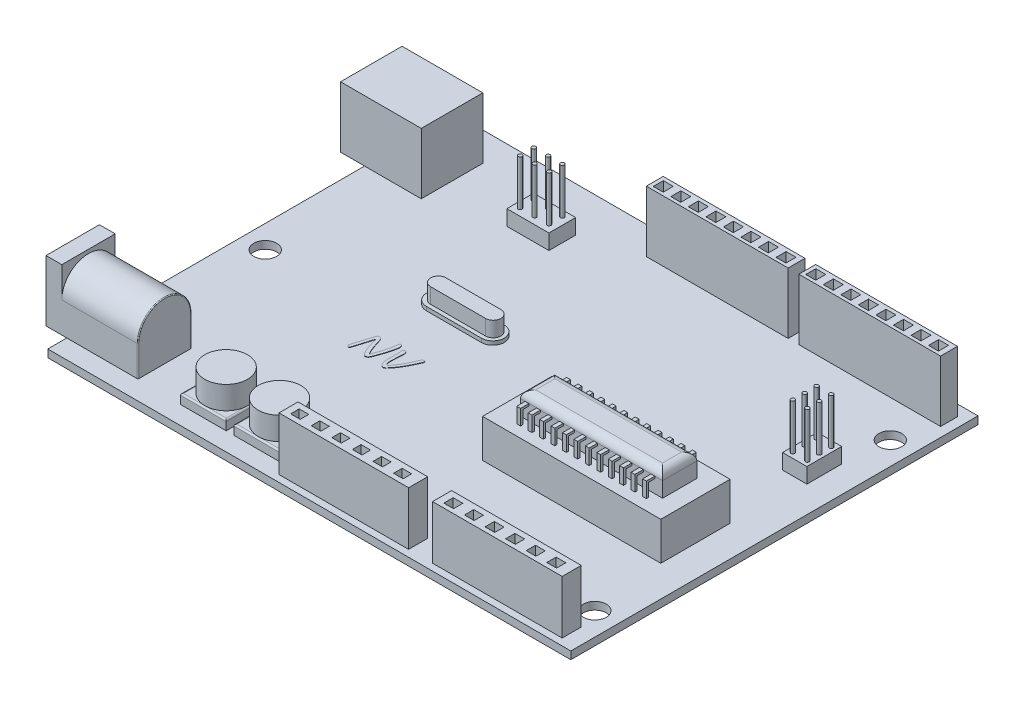
from build123d import *

# Parameters (mm, degrees)
SKETCH1_W                 = 68.6
SKETCH1_H                 = 53.4
BOSS_EXTRUDE1_DEPTH       = 1
SKETCH2_W                 = 17
SKETCH2_H                 = 2.5
BOSS_EXTRUDE2_DEPTH       = 7
SKETCH3_W                 = 1.250867438
SKETCH3_H                 = 1.125780694
CUT_EXTRUDE1_DEPTH        = 7
SKETCH4_W                 = 1.272885096
SKETCH4_H                 = 1.221969693
CUT_EXTRUDE2_DEPTH        = 7
SKETCH5_W                 = 6
SKETCH5_H                 = 6
BOSS_EXTRUDE3_DEPTH       = 1.25
SKETCH6_R                 = 2.8
BOSS_EXTRUDE4_DEPTH       = 3
SKETCH7_W                 = 12.070870776
SKETCH7_H                 = 7.004857653
BOSS_EXTRUDE5_DEPTH       = 8
CUT_EXTRUDE3_START        = -10
CUT_EXTRUDE3_DEPTH        = 10
SKETCH9_R                 = 2.5
SKETCH9_R_2               = 0.145183716
CUT_EXTRUDE4_DEPTH        = 10
FILLET1_R                 = 0.11
SKETCH10_W                = 10.586588213
SKETCH10_H                = 8.069045894
BOSS_EXTRUDE6_DEPTH       = 8
SKETCH11_W                = 2.827244698
SKETCH11_H                = 1.739842891
CUT_EXTRUDE5_DEPTH        = 8
FILLET2_R                 = 0.11
SKETCH12_W                = 23.37632425
SKETCH12_H                = 9.090792763
BOSS_EXTRUDE7_DEPTH       = 5
SKETCH13_W                = 18.636125166
SKETCH13_H                = 4.5
BOSS_EXTRUDE8_DEPTH       = 3
FILLET3_R                 = 1
SKETCH18_W                = 18.593917913
SKETCH18_H                = 2.209711983
BOSS_EXTRUDE9_DEPTH       = 8
SKETCH19_W                = 1.298853985
SKETCH19_H                = 1.323131629
CUT_EXTRUDE6_DEPTH        = 8
LPATTERN1_COUNT           = 8
LPATTERN1_PITCH           = 2.3
LPATTERN3_COUNT           = 2
LPATTERN3_PITCH           = 20
LPATTERN3_COPY_1_SKETCH_W = 1.298853985
LPATTERN3_COPY_1_SKETCH_H = 1.323131629
LPATTERN3_COPY_1_DEPTH    = 8
LPATTERN3_COPY_2_SKETCH_W = 1.298853985
LPATTERN3_COPY_2_SKETCH_H = 1.323131629
LPATTERN3_COPY_2_DEPTH    = 8
LPATTERN3_COPY_3_SKETCH_W = 1.298853985
LPATTERN3_COPY_3_SKETCH_H = 1.323131629
LPATTERN3_COPY_3_DEPTH    = 8
LPATTERN3_COPY_4_SKETCH_W = 1.298853985
LPATTERN3_COPY_4_SKETCH_H = 1.323131629
LPATTERN3_COPY_4_DEPTH    = 8
LPATTERN3_COPY_5_SKETCH_W = 1.298853985
LPATTERN3_COPY_5_SKETCH_H = 1.323131629
LPATTERN3_COPY_5_DEPTH    = 8
LPATTERN3_COPY_6_SKETCH_W = 1.298853985
LPATTERN3_COPY_6_SKETCH_H = 1.323131629
LPATTERN3_COPY_6_DEPTH    = 8
LPATTERN3_COPY_7_SKETCH_W = 1.298853985
LPATTERN3_COPY_7_SKETCH_H = 1.323131629
LPATTERN3_COPY_7_DEPTH    = 8
BOSS_EXTRUDE12_DEPTH      = 0.5
BOSS_EXTRUDE13_DEPTH      = 2
SKETCH24_W                = 0.493067156
SKETCH24_H                = 0.308166972
BOSS_EXTRUDE14_DEPTH      = 2
BOSS_EXTRUDE15_REACH      = 79.92
SKETCH26_W                = 0.493067156
SKETCH26_H                = 0.283057265
LPATTERN4_COUNT           = 12
LPATTERN4_PITCH           = 1.5
MIRROR1_COPY_1_SKETCH_W   = 0.493067156
MIRROR1_COPY_1_SKETCH_H   = 0.308166972
MIRROR1_COPY_1_DEPTH      = 2
MIRROR1_COPY_2_SKETCH_W   = 0.493067156
MIRROR1_COPY_2_SKETCH_H   = 0.308166972
MIRROR1_COPY_2_DEPTH      = 2
MIRROR1_COPY_3_SKETCH_W   = 0.493067156
MIRROR1_COPY_3_SKETCH_H   = 0.308166972
MIRROR1_COPY_3_DEPTH      = 2
MIRROR1_COPY_4_SKETCH_W   = 0.493067156
MIRROR1_COPY_4_SKETCH_H   = 0.308166972
MIRROR1_COPY_4_DEPTH      = 2
MIRROR1_COPY_5_SKETCH_W   = 0.493067156
MIRROR1_COPY_5_SKETCH_H   = 0.308166972
MIRROR1_COPY_5_DEPTH      = 2
MIRROR1_COPY_6_SKETCH_W   = 0.493067156
MIRROR1_COPY_6_SKETCH_H   = 0.308166972
MIRROR1_COPY_6_DEPTH      = 2
MIRROR1_COPY_7_SKETCH_W   = 0.493067156
MIRROR1_COPY_7_SKETCH_H   = 0.308166972
MIRROR1_COPY_7_DEPTH      = 2
MIRROR1_COPY_8_SKETCH_W   = 0.493067156
MIRROR1_COPY_8_SKETCH_H   = 0.308166972
MIRROR1_COPY_8_DEPTH      = 2
MIRROR1_COPY_9_SKETCH_W   = 0.493067156
MIRROR1_COPY_9_SKETCH_H   = 0.308166972
MIRROR1_COPY_9_DEPTH      = 2
MIRROR1_COPY_10_SKETCH_W  = 0.493067156
MIRROR1_COPY_10_SKETCH_H  = 0.308166972
MIRROR1_COPY_10_DEPTH     = 2
MIRROR1_COPY_11_SKETCH_W  = 0.493067156
MIRROR1_COPY_11_SKETCH_H  = 0.308166972
MIRROR1_COPY_11_DEPTH     = 2
MIRROR1_COPY_12_REACH     = 79.92
MIRROR1_COPY_12_SKETCH_W  = 0.493067156
MIRROR1_COPY_12_SKETCH_H  = 0.283057265
MIRROR1_COPY_13_REACH     = 79.92
MIRROR1_COPY_13_SKETCH_W  = 0.493067156
MIRROR1_COPY_13_SKETCH_H  = 0.283057265
MIRROR1_COPY_14_REACH     = 79.92
MIRROR1_COPY_14_SKETCH_W  = 0.493067156
MIRROR1_COPY_14_SKETCH_H  = 0.283057265
MIRROR1_COPY_15_REACH     = 79.92
MIRROR1_COPY_15_SKETCH_W  = 0.493067156
MIRROR1_COPY_15_SKETCH_H  = 0.283057265
MIRROR1_COPY_16_REACH     = 79.92
MIRROR1_COPY_16_SKETCH_W  = 0.493067156
MIRROR1_COPY_16_SKETCH_H  = 0.283057265
MIRROR1_COPY_17_REACH     = 79.92
MIRROR1_COPY_17_SKETCH_W  = 0.493067156
MIRROR1_COPY_17_SKETCH_H  = 0.283057265
MIRROR1_COPY_18_REACH     = 79.92
MIRROR1_COPY_18_SKETCH_W  = 0.493067156
MIRROR1_COPY_18_SKETCH_H  = 0.283057265
MIRROR1_COPY_19_REACH     = 79.92
MIRROR1_COPY_19_SKETCH_W  = 0.493067156
MIRROR1_COPY_19_SKETCH_H  = 0.283057265
MIRROR1_COPY_20_REACH     = 79.92
MIRROR1_COPY_20_SKETCH_W  = 0.493067156
MIRROR1_COPY_20_SKETCH_H  = 0.283057265
MIRROR1_COPY_21_REACH     = 79.92
MIRROR1_COPY_21_SKETCH_W  = 0.493067156
MIRROR1_COPY_21_SKETCH_H  = 0.283057265
MIRROR1_COPY_22_REACH     = 79.92
MIRROR1_COPY_22_SKETCH_W  = 0.493067156
MIRROR1_COPY_22_SKETCH_H  = 0.283057265
SKETCH27_W                = 5.519409892
SKETCH27_H                = 3.506448638
BOSS_EXTRUDE16_DEPTH      = 2
SKETCH28_R                = 0.25
BOSS_EXTRUDE17_DEPTH      = 6
SKETCH33_W                = 3.184955376
SKETCH33_H                = 4.555757605
BOSS_EXTRUDE20_DEPTH      = 2
SKETCH34_R                = 0.25
BOSS_EXTRUDE21_DEPTH      = 6
BOSS_EXTRUDE22_DEPTH      = 0.05
FILLET5_R                 = 0.2
SKETCH36_R                = 1.5
CUT_EXTRUDE7_DEPTH        = 88.301317426


# Read off the part's stored shape, not the designer's step: Cut-Extrude3
with BuildPart() as part:
    # Sketch1 → Boss-Extrude1 (new body)
    with BuildSketch(Plane(origin=(0, 0, 0), x_dir=(1, 0, 0), z_dir=(0, 1, 0))):
        with Locations((34.3, -26.7)):
            Rectangle(SKETCH1_W, SKETCH1_H)
    extrude(amount=BOSS_EXTRUDE1_DEPTH)

    # Sketch2 → Boss-Extrude2 (add)
    with BuildSketch(Plane(origin=(0, 1, 0), x_dir=(1, 0, 0), z_dir=(0, 1, 0))):
        with Locations((58.06648132, -51.25)):
            Rectangle(SKETCH2_W, SKETCH2_H)
        with Locations((37.921616992, -51.25)):
            Rectangle(SKETCH2_W, SKETCH2_H)
    extrude(amount=BOSS_EXTRUDE2_DEPTH)

    # Sketch3 → Cut-Extrude1 (cut)
    with BuildSketch(Plane(origin=(0, 8, 0), x_dir=(1, 0, 0), z_dir=(0, 1, 0))):
        with Locations((33.622657918, -51.279545155)):
            Rectangle(SKETCH3_W, SKETCH3_H)
        with Locations((30.922657918, -51.279545155)):
            Rectangle(SKETCH3_W, SKETCH3_H)
        with Locations((36.322657918, -51.279545155)):
            Rectangle(SKETCH3_W, SKETCH3_H)
        with Locations((39.022657918, -51.279545155)):
            Rectangle(SKETCH3_W, SKETCH3_H)
        with Locations((41.722657918, -51.279545155)):
            Rectangle(SKETCH3_W, SKETCH3_H)
        with Locations((44.422657918, -51.279545155)):
            Rectangle(SKETCH3_W, SKETCH3_H)
    extrude(amount=-CUT_EXTRUDE1_DEPTH, mode=Mode.SUBTRACT)

    # Sketch4 → Cut-Extrude2 (cut)
    with BuildSketch(Plane(origin=(0, 8, 0), x_dir=(1, 0, 0), z_dir=(0, 1, 0))):
        with Locations((53.813633763, -51.319835509)):
            Rectangle(SKETCH4_W, SKETCH4_H)
        with Locations((51.113633763, -51.319835509)):
            Rectangle(SKETCH4_W, SKETCH4_H)
        with Locations((56.513633763, -51.319835509)):
            Rectangle(SKETCH4_W, SKETCH4_H)
        with Locations((59.213633763, -51.319835509)):
            Rectangle(SKETCH4_W, SKETCH4_H)
        with Locations((61.913633763, -51.319835509)):
            Rectangle(SKETCH4_W, SKETCH4_H)
        with Locations((64.613633763, -51.319835509)):
            Rectangle(SKETCH4_W, SKETCH4_H)
    extrude(amount=-CUT_EXTRUDE2_DEPTH, mode=Mode.SUBTRACT)

    # Sketch5 → Boss-Extrude3 (add)
    with BuildSketch(Plane(origin=(0, 1, 0), x_dir=(1, 0, 0), z_dir=(0, 1, 0))):
        with Locations((18, -48)):
            Rectangle(SKETCH5_W, SKETCH5_H)
        with Locations((25, -48)):
            Rectangle(SKETCH5_W, SKETCH5_H)
    extrude(amount=BOSS_EXTRUDE3_DEPTH)

    # Sketch6 → Boss-Extrude4 (add)
    with BuildSketch(Plane(origin=(0, 2.25, 0), x_dir=(1, 0, 0), z_dir=(0, 1, 0))):
        with Locations(Location((18, -48, 0), (0, 0, 270))):
            Circle(SKETCH6_R)
        with Locations(Location((25, -48, 0), (0, 0, 270))):
            Circle(SKETCH6_R)
    extrude(amount=BOSS_EXTRUDE4_DEPTH)

    # Sketch7 → Boss-Extrude5 (add)
    with BuildSketch(Plane(origin=(0, 1, 0), x_dir=(1, 0, 0), z_dir=(0, 1, 0))):
        with Locations((3.309759226, -47.401856098)):
            Rectangle(SKETCH7_W, SKETCH7_H)
    extrude(amount=BOSS_EXTRUDE5_DEPTH)

    # Cut-Extrude3 outline → Cut-Extrude3 (cut)
    with BuildSketch(Plane(origin=(9.345194614, 0, 0), x_dir=(0, 0, -1), z_dir=(1, 0, 0)).offset(CUT_EXTRUDE3_START)):
        with BuildLine():
            Line((-50.904284924, 9), (-50.904284924, 5))
            ThreePointArc((-50.904284924, 5), (-47.401856098, 8.502428826), (-43.899427271, 5))
            Line((-43.899427271, 5), (-43.899427271, 9))
            Line((-43.899427271, 9), (-50.904284924, 9))
        make_face()
    extrude(amount=CUT_EXTRUDE3_DEPTH, mode=Mode.SUBTRACT)

    # Sketch9 → Cut-Extrude4 (cut)
    with BuildSketch(Plane.ZY.offset(2.725676162)):
        with Locations((47.433127783, 5.128276599)):
            Circle(SKETCH9_R)
        with Locations((47.433127783, 5.128276599)):
            Circle(SKETCH9_R_2, mode=Mode.SUBTRACT)
    extrude(amount=-CUT_EXTRUDE4_DEPTH, mode=Mode.SUBTRACT)

    # Fillet1
    fillet1_edges = [part.edges().sort_by_distance(p)[0] for p in [
        (9.345194614, 3, 43.899427271),
        (9.345194614, 3, 50.904284924),
        (9.345194614, 8.502428826, 47.401856098),
        (-2.725676162, 5.128276599, 47.287944068),
    ]]
    fillet(fillet1_edges, radius=FILLET1_R)

    # Sketch10 → Boss-Extrude6 (add)
    with BuildSketch(Plane(origin=(0, 1, 0), x_dir=(1, 0, 0), z_dir=(0, 1, 0))):
        with Locations((2.145682788, -7.818432608)):
            Rectangle(SKETCH10_W, SKETCH10_H)
    extrude(amount=BOSS_EXTRUDE6_DEPTH)

    # Sketch11 → Cut-Extrude5 (cut)
    with BuildSketch(Plane.ZY.offset(3.147611319)):
        Polygon((5.435253555, 3.098459893), (5.435253555, 5.659895261), (6.474326393, 6.698968098), (9.301571091, 6.698968098), (10.340643928, 5.659895261), (10.340643928, 3.098459893), align=None)
        with Locations((7.887948742, 4.789973815)):
            Rectangle(SKETCH11_W, SKETCH11_H, mode=Mode.SUBTRACT)
    extrude(amount=-CUT_EXTRUDE5_DEPTH, mode=Mode.SUBTRACT)

    # Fillet2
    fillet2_edges = [part.edges().sort_by_distance(p)[0] for p in [
        (-3.147611319, 4.789973815, 6.474326393),
        (-3.147611319, 5.659895261, 7.887948742),
        (-3.147611319, 4.789973815, 9.301571091),
        (-3.147611319, 3.92005237, 7.887948742),
    ]]
    fillet(fillet2_edges, radius=FILLET2_R)

    # Sketch12 → Boss-Extrude7 (add)
    with BuildSketch(Plane(origin=(0, 1, 0), x_dir=(1, 0, 0), z_dir=(0, 1, 0))):
        with Locations((52.855806889, -32.9986207)):
            Rectangle(SKETCH12_W, SKETCH12_H)
    extrude(amount=BOSS_EXTRUDE7_DEPTH)

    # Sketch13 → Boss-Extrude8 (add)
    with BuildSketch(Plane(origin=(0, 6, 0), x_dir=(1, 0, 0), z_dir=(0, 1, 0))):
        with Locations((52.95320824, -32.794017082)):
            Rectangle(SKETCH13_W, SKETCH13_H)
    extrude(amount=BOSS_EXTRUDE8_DEPTH)

    # Fillet3
    fillet3_edges = [part.edges().sort_by_distance(p)[0] for p in [
        (43.635145657, 9, 32.794017082),
        (52.95320824, 9, 35.044017082),
        (62.271270823, 9, 32.794017082),
        (52.95320824, 9, 30.544017082),
    ]]
    fillet(fillet3_edges, radius=FILLET3_R)

    # Sketch18 → Boss-Extrude9 (add)
    with BuildSketch(Plane(origin=(0, 1, 0), x_dir=(1, 0, 0), z_dir=(0, 1, 0))):
        with Locations((38.056256007, -2.551542774)):
            Rectangle(SKETCH18_W, SKETCH18_H)
    boss_extrude9 = extrude(amount=BOSS_EXTRUDE9_DEPTH)

    # Sketch19 → Cut-Extrude6 (cut)
    with BuildSketch(Plane(origin=(0, 9, 0), x_dir=(1, 0, 0), z_dir=(0, 1, 0))):
        with Locations((29.900276696, -2.578233353)):
            Rectangle(SKETCH19_W, SKETCH19_H)
    cut_extrude6 = extrude(amount=-CUT_EXTRUDE6_DEPTH, mode=Mode.SUBTRACT)

    # LPattern1: Cut-Extrude6 ×8
    with Locations(*[(i * LPATTERN1_PITCH, 0, 0) for i in range(1, LPATTERN1_COUNT)]):
        add(cut_extrude6, mode=Mode.SUBTRACT)

    # LPattern3: Boss-Extrude9, Cut-Extrude6 ×2
    with Locations(*[(i * LPATTERN3_PITCH, 0, 0) for i in range(1, LPATTERN3_COUNT)]):
        add(boss_extrude9)
        add(cut_extrude6, mode=Mode.SUBTRACT)

    # LPattern3 copy 1 sketch → LPattern3 copy 1 (cut)
    with BuildSketch(Plane(origin=(22.3, 9, 0), x_dir=(1, 0, 0), z_dir=(0, 1, 0))):
        with Locations((29.900276696, -2.578233353)):
            Rectangle(LPATTERN3_COPY_1_SKETCH_W, LPATTERN3_COPY_1_SKETCH_H)
    extrude(amount=-LPATTERN3_COPY_1_DEPTH, mode=Mode.SUBTRACT)

    # LPattern3 copy 2 sketch → LPattern3 copy 2 (cut)
    with BuildSketch(Plane(origin=(24.6, 9, 0), x_dir=(1, 0, 0), z_dir=(0, 1, 0))):
        with Locations((29.900276696, -2.578233353)):
            Rectangle(LPATTERN3_COPY_2_SKETCH_W, LPATTERN3_COPY_2_SKETCH_H)
    extrude(amount=-LPATTERN3_COPY_2_DEPTH, mode=Mode.SUBTRACT)

    # LPattern3 copy 3 sketch → LPattern3 copy 3 (cut)
    with BuildSketch(Plane(origin=(26.9, 9, 0), x_dir=(1, 0, 0), z_dir=(0, 1, 0))):
        with Locations((29.900276696, -2.578233353)):
            Rectangle(LPATTERN3_COPY_3_SKETCH_W, LPATTERN3_COPY_3_SKETCH_H)
    extrude(amount=-LPATTERN3_COPY_3_DEPTH, mode=Mode.SUBTRACT)

    # LPattern3 copy 4 sketch → LPattern3 copy 4 (cut)
    with BuildSketch(Plane(origin=(29.2, 9, 0), x_dir=(1, 0, 0), z_dir=(0, 1, 0))):
        with Locations((29.900276696, -2.578233353)):
            Rectangle(LPATTERN3_COPY_4_SKETCH_W, LPATTERN3_COPY_4_SKETCH_H)
    extrude(amount=-LPATTERN3_COPY_4_DEPTH, mode=Mode.SUBTRACT)

    # LPattern3 copy 5 sketch → LPattern3 copy 5 (cut)
    with BuildSketch(Plane(origin=(31.5, 9, 0), x_dir=(1, 0, 0), z_dir=(0, 1, 0))):
        with Locations((29.900276696, -2.578233353)):
            Rectangle(LPATTERN3_COPY_5_SKETCH_W, LPATTERN3_COPY_5_SKETCH_H)
    extrude(amount=-LPATTERN3_COPY_5_DEPTH, mode=Mode.SUBTRACT)

    # LPattern3 copy 6 sketch → LPattern3 copy 6 (cut)
    with BuildSketch(Plane(origin=(33.8, 9, 0), x_dir=(1, 0, 0), z_dir=(0, 1, 0))):
        with Locations((29.900276696, -2.578233353)):
            Rectangle(LPATTERN3_COPY_6_SKETCH_W, LPATTERN3_COPY_6_SKETCH_H)
    extrude(amount=-LPATTERN3_COPY_6_DEPTH, mode=Mode.SUBTRACT)

    # LPattern3 copy 7 sketch → LPattern3 copy 7 (cut)
    with BuildSketch(Plane(origin=(36.1, 9, 0), x_dir=(1, 0, 0), z_dir=(0, 1, 0))):
        with Locations((29.900276696, -2.578233353)):
            Rectangle(LPATTERN3_COPY_7_SKETCH_W, LPATTERN3_COPY_7_SKETCH_H)
    extrude(amount=-LPATTERN3_COPY_7_DEPTH, mode=Mode.SUBTRACT)

    # Sketch22 → Boss-Extrude12 (add)
    with BuildSketch(Plane(origin=(0, 1, 0), x_dir=(1, 0, 0), z_dir=(0, 1, 0))):
        with BuildLine():
            Line((20.492984875, -21.236243014), (27.700684852, -21.236243014))
            ThreePointArc((27.700684852, -21.236243014), (29.200684852, -22.736243014), (27.700684852, -24.236243014))
            Line((27.700684852, -24.236243014), (20.492984875, -24.236243014))
            ThreePointArc((20.492984875, -24.236243014), (18.992984875, -22.736243014), (20.492984875, -21.236243014))
        make_face()
    extrude(amount=BOSS_EXTRUDE12_DEPTH)

    # Sketch23 → Boss-Extrude13 (add)
    with BuildSketch(Plane(origin=(0, 1.5, 0), x_dir=(1, 0, 0), z_dir=(0, 1, 0))):
        with BuildLine():
            Line((20.532869644, -21.71113498), (27.740569621, -21.71113498))
            ThreePointArc((27.740569621, -21.71113498), (28.747050248, -22.717615607), (27.740569621, -23.724096235))
            Line((27.740569621, -23.724096235), (20.532869644, -23.724096235))
            ThreePointArc((20.532869644, -23.724096235), (19.526389016, -22.717615607), (20.532869644, -21.71113498))
        make_face()
    extrude(amount=BOSS_EXTRUDE13_DEPTH)

    # Sketch24 → Boss-Extrude14 (add)
    with BuildSketch(Plane(origin=(0, 6, 0), x_dir=(1, 0, 0), z_dir=(0, 1, 0))):
        with Locations((44.50595764, -35.996011084)):
            Rectangle(SKETCH24_W, SKETCH24_H)
    boss_extrude14 = extrude(amount=BOSS_EXTRUDE14_DEPTH)

    # Sketch26 → Boss-Extrude15 (add, up to next)
    with BuildSketch(Plane(origin=(0, 0, 35.841927598), x_dir=(-1, 0, 0), z_dir=(0, 0, -1)), mode=Mode.PRIVATE) as boss_extrude15_sk1:
        with Locations((-44.50595764, 7.858471367)):
            Rectangle(SKETCH26_W, SKETCH26_H)
    boss_extrude15_tool1 = extrude(boss_extrude15_sk1.sketch, amount=BOSS_EXTRUDE15_REACH, mode=Mode.PRIVATE) - part.part
    boss_extrude15 = boss_extrude15_tool1.solids().sort_by_distance((44.505958, 7.858471, 35.841928))[0]
    add(boss_extrude15)

    # LPattern4: Boss-Extrude14, Boss-Extrude15 ×12
    with Locations(*[(i * LPATTERN4_PITCH, 0, 0) for i in range(1, LPATTERN4_COUNT)]):
        add(boss_extrude14)
        add(boss_extrude15)

    # Mirror1: Boss-Extrude14, Boss-Extrude15 across plane
    add(boss_extrude14.mirror(Plane.XY.offset(32.877393472)))
    add(boss_extrude15.mirror(Plane.XY.offset(32.877393472)))

    # Mirror1 copy 1 sketch → Mirror1 copy 1 (add)
    with BuildSketch(Plane(origin=(1.5, 6, 65.754786943), x_dir=(1, 0, 0), z_dir=(0, 1, 0))):
        with Locations((44.50595764, 35.996011084)):
            Rectangle(MIRROR1_COPY_1_SKETCH_W, MIRROR1_COPY_1_SKETCH_H)
    extrude(amount=MIRROR1_COPY_1_DEPTH)

    # Mirror1 copy 2 sketch → Mirror1 copy 2 (add)
    with BuildSketch(Plane(origin=(3, 6, 65.754786943), x_dir=(1, 0, 0), z_dir=(0, 1, 0))):
        with Locations((44.50595764, 35.996011084)):
            Rectangle(MIRROR1_COPY_2_SKETCH_W, MIRROR1_COPY_2_SKETCH_H)
    extrude(amount=MIRROR1_COPY_2_DEPTH)

    # Mirror1 copy 3 sketch → Mirror1 copy 3 (add)
    with BuildSketch(Plane(origin=(4.5, 6, 65.754786943), x_dir=(1, 0, 0), z_dir=(0, 1, 0))):
        with Locations((44.50595764, 35.996011084)):
            Rectangle(MIRROR1_COPY_3_SKETCH_W, MIRROR1_COPY_3_SKETCH_H)
    extrude(amount=MIRROR1_COPY_3_DEPTH)

    # Mirror1 copy 4 sketch → Mirror1 copy 4 (add)
    with BuildSketch(Plane(origin=(6, 6, 65.754786943), x_dir=(1, 0, 0), z_dir=(0, 1, 0))):
        with Locations((44.50595764, 35.996011084)):
            Rectangle(MIRROR1_COPY_4_SKETCH_W, MIRROR1_COPY_4_SKETCH_H)
    extrude(amount=MIRROR1_COPY_4_DEPTH)

    # Mirror1 copy 5 sketch → Mirror1 copy 5 (add)
    with BuildSketch(Plane(origin=(7.5, 6, 65.754786943), x_dir=(1, 0, 0), z_dir=(0, 1, 0))):
        with Locations((44.50595764, 35.996011084)):
            Rectangle(MIRROR1_COPY_5_SKETCH_W, MIRROR1_COPY_5_SKETCH_H)
    extrude(amount=MIRROR1_COPY_5_DEPTH)

    # Mirror1 copy 6 sketch → Mirror1 copy 6 (add)
    with BuildSketch(Plane(origin=(9, 6, 65.754786943), x_dir=(1, 0, 0), z_dir=(0, 1, 0))):
        with Locations((44.50595764, 35.996011084)):
            Rectangle(MIRROR1_COPY_6_SKETCH_W, MIRROR1_COPY_6_SKETCH_H)
    extrude(amount=MIRROR1_COPY_6_DEPTH)

    # Mirror1 copy 7 sketch → Mirror1 copy 7 (add)
    with BuildSketch(Plane(origin=(10.5, 6, 65.754786943), x_dir=(1, 0, 0), z_dir=(0, 1, 0))):
        with Locations((44.50595764, 35.996011084)):
            Rectangle(MIRROR1_COPY_7_SKETCH_W, MIRROR1_COPY_7_SKETCH_H)
    extrude(amount=MIRROR1_COPY_7_DEPTH)

    # Mirror1 copy 8 sketch → Mirror1 copy 8 (add)
    with BuildSketch(Plane(origin=(12, 6, 65.754786943), x_dir=(1, 0, 0), z_dir=(0, 1, 0))):
        with Locations((44.50595764, 35.996011084)):
            Rectangle(MIRROR1_COPY_8_SKETCH_W, MIRROR1_COPY_8_SKETCH_H)
    extrude(amount=MIRROR1_COPY_8_DEPTH)

    # Mirror1 copy 9 sketch → Mirror1 copy 9 (add)
    with BuildSketch(Plane(origin=(13.5, 6, 65.754786943), x_dir=(1, 0, 0), z_dir=(0, 1, 0))):
        with Locations((44.50595764, 35.996011084)):
            Rectangle(MIRROR1_COPY_9_SKETCH_W, MIRROR1_COPY_9_SKETCH_H)
    extrude(amount=MIRROR1_COPY_9_DEPTH)

    # Mirror1 copy 10 sketch → Mirror1 copy 10 (add)
    with BuildSketch(Plane(origin=(15, 6, 65.754786943), x_dir=(1, 0, 0), z_dir=(0, 1, 0))):
        with Locations((44.50595764, 35.996011084)):
            Rectangle(MIRROR1_COPY_10_SKETCH_W, MIRROR1_COPY_10_SKETCH_H)
    extrude(amount=MIRROR1_COPY_10_DEPTH)

    # Mirror1 copy 11 sketch → Mirror1 copy 11 (add)
    with BuildSketch(Plane(origin=(16.5, 6, 65.754786943), x_dir=(1, 0, 0), z_dir=(0, 1, 0))):
        with Locations((44.50595764, 35.996011084)):
            Rectangle(MIRROR1_COPY_11_SKETCH_W, MIRROR1_COPY_11_SKETCH_H)
    extrude(amount=MIRROR1_COPY_11_DEPTH)

    # Mirror1 copy 12 sketch → Mirror1 copy 12 (add, up to next)
    with BuildSketch(Plane(origin=(1.5, 0, 29.912859345), x_dir=(-1, 0, 0), z_dir=(0, 0, 1)), mode=Mode.PRIVATE) as mirror1_copy_12_sk1:
        with Locations((-44.50595764, -7.858471367)):
            Rectangle(MIRROR1_COPY_12_SKETCH_W, MIRROR1_COPY_12_SKETCH_H)
    mirror1_copy_12_tool1 = extrude(mirror1_copy_12_sk1.sketch, amount=MIRROR1_COPY_12_REACH, mode=Mode.PRIVATE) - part.part
    add(mirror1_copy_12_tool1.solids().sort_by_distance((46.005958, 7.858471, 29.912858943))[0])

    # Mirror1 copy 13 sketch → Mirror1 copy 13 (add, up to next)
    with BuildSketch(Plane(origin=(3, 0, 29.912859345), x_dir=(-1, 0, 0), z_dir=(0, 0, 1)), mode=Mode.PRIVATE) as mirror1_copy_13_sk1:
        with Locations((-44.50595764, -7.858471367)):
            Rectangle(MIRROR1_COPY_13_SKETCH_W, MIRROR1_COPY_13_SKETCH_H)
    mirror1_copy_13_tool1 = extrude(mirror1_copy_13_sk1.sketch, amount=MIRROR1_COPY_13_REACH, mode=Mode.PRIVATE) - part.part
    add(mirror1_copy_13_tool1.solids().sort_by_distance((47.505958, 7.858471, 29.912858943))[0])

    # Mirror1 copy 14 sketch → Mirror1 copy 14 (add, up to next)
    with BuildSketch(Plane(origin=(4.5, 0, 29.912859345), x_dir=(-1, 0, 0), z_dir=(0, 0, 1)), mode=Mode.PRIVATE) as mirror1_copy_14_sk1:
        with Locations((-44.50595764, -7.858471367)):
            Rectangle(MIRROR1_COPY_14_SKETCH_W, MIRROR1_COPY_14_SKETCH_H)
    mirror1_copy_14_tool1 = extrude(mirror1_copy_14_sk1.sketch, amount=MIRROR1_COPY_14_REACH, mode=Mode.PRIVATE) - part.part
    add(mirror1_copy_14_tool1.solids().sort_by_distance((49.005958, 7.858471, 29.912858943))[0])

    # Mirror1 copy 15 sketch → Mirror1 copy 15 (add, up to next)
    with BuildSketch(Plane(origin=(6, 0, 29.912859345), x_dir=(-1, 0, 0), z_dir=(0, 0, 1)), mode=Mode.PRIVATE) as mirror1_copy_15_sk1:
        with Locations((-44.50595764, -7.858471367)):
            Rectangle(MIRROR1_COPY_15_SKETCH_W, MIRROR1_COPY_15_SKETCH_H)
    mirror1_copy_15_tool1 = extrude(mirror1_copy_15_sk1.sketch, amount=MIRROR1_COPY_15_REACH, mode=Mode.PRIVATE) - part.part
    add(mirror1_copy_15_tool1.solids().sort_by_distance((50.505958, 7.858471, 29.912858943))[0])

    # Mirror1 copy 16 sketch → Mirror1 copy 16 (add, up to next)
    with BuildSketch(Plane(origin=(7.5, 0, 29.912859345), x_dir=(-1, 0, 0), z_dir=(0, 0, 1)), mode=Mode.PRIVATE) as mirror1_copy_16_sk1:
        with Locations((-44.50595764, -7.858471367)):
            Rectangle(MIRROR1_COPY_16_SKETCH_W, MIRROR1_COPY_16_SKETCH_H)
    mirror1_copy_16_tool1 = extrude(mirror1_copy_16_sk1.sketch, amount=MIRROR1_COPY_16_REACH, mode=Mode.PRIVATE) - part.part
    add(mirror1_copy_16_tool1.solids().sort_by_distance((52.005958, 7.858471, 29.912858943))[0])

    # Mirror1 copy 17 sketch → Mirror1 copy 17 (add, up to next)
    with BuildSketch(Plane(origin=(9, 0, 29.912859345), x_dir=(-1, 0, 0), z_dir=(0, 0, 1)), mode=Mode.PRIVATE) as mirror1_copy_17_sk1:
        with Locations((-44.50595764, -7.858471367)):
            Rectangle(MIRROR1_COPY_17_SKETCH_W, MIRROR1_COPY_17_SKETCH_H)
    mirror1_copy_17_tool1 = extrude(mirror1_copy_17_sk1.sketch, amount=MIRROR1_COPY_17_REACH, mode=Mode.PRIVATE) - part.part
    add(mirror1_copy_17_tool1.solids().sort_by_distance((53.505958, 7.858471, 29.912858943))[0])

    # Mirror1 copy 18 sketch → Mirror1 copy 18 (add, up to next)
    with BuildSketch(Plane(origin=(10.5, 0, 29.912859345), x_dir=(-1, 0, 0), z_dir=(0, 0, 1)), mode=Mode.PRIVATE) as mirror1_copy_18_sk1:
        with Locations((-44.50595764, -7.858471367)):
            Rectangle(MIRROR1_COPY_18_SKETCH_W, MIRROR1_COPY_18_SKETCH_H)
    mirror1_copy_18_tool1 = extrude(mirror1_copy_18_sk1.sketch, amount=MIRROR1_COPY_18_REACH, mode=Mode.PRIVATE) - part.part
    add(mirror1_copy_18_tool1.solids().sort_by_distance((55.005958, 7.858471, 29.912858943))[0])

    # Mirror1 copy 19 sketch → Mirror1 copy 19 (add, up to next)
    with BuildSketch(Plane(origin=(12, 0, 29.912859345), x_dir=(-1, 0, 0), z_dir=(0, 0, 1)), mode=Mode.PRIVATE) as mirror1_copy_19_sk1:
        with Locations((-44.50595764, -7.858471367)):
            Rectangle(MIRROR1_COPY_19_SKETCH_W, MIRROR1_COPY_19_SKETCH_H)
    mirror1_copy_19_tool1 = extrude(mirror1_copy_19_sk1.sketch, amount=MIRROR1_COPY_19_REACH, mode=Mode.PRIVATE) - part.part
    add(mirror1_copy_19_tool1.solids().sort_by_distance((56.505958, 7.858471, 29.912858943))[0])

    # Mirror1 copy 20 sketch → Mirror1 copy 20 (add, up to next)
    with BuildSketch(Plane(origin=(13.5, 0, 29.912859345), x_dir=(-1, 0, 0), z_dir=(0, 0, 1)), mode=Mode.PRIVATE) as mirror1_copy_20_sk1:
        with Locations((-44.50595764, -7.858471367)):
            Rectangle(MIRROR1_COPY_20_SKETCH_W, MIRROR1_COPY_20_SKETCH_H)
    mirror1_copy_20_tool1 = extrude(mirror1_copy_20_sk1.sketch, amount=MIRROR1_COPY_20_REACH, mode=Mode.PRIVATE) - part.part
    add(mirror1_copy_20_tool1.solids().sort_by_distance((58.005958, 7.858471, 29.912858943))[0])

    # Mirror1 copy 21 sketch → Mirror1 copy 21 (add, up to next)
    with BuildSketch(Plane(origin=(15, 0, 29.912859345), x_dir=(-1, 0, 0), z_dir=(0, 0, 1)), mode=Mode.PRIVATE) as mirror1_copy_21_sk1:
        with Locations((-44.50595764, -7.858471367)):
            Rectangle(MIRROR1_COPY_21_SKETCH_W, MIRROR1_COPY_21_SKETCH_H)
    mirror1_copy_21_tool1 = extrude(mirror1_copy_21_sk1.sketch, amount=MIRROR1_COPY_21_REACH, mode=Mode.PRIVATE) - part.part
    add(mirror1_copy_21_tool1.solids().sort_by_distance((59.505958, 7.858471, 29.912858943))[0])

    # Mirror1 copy 22 sketch → Mirror1 copy 22 (add, up to next)
    with BuildSketch(Plane(origin=(16.5, 0, 29.912859345), x_dir=(-1, 0, 0), z_dir=(0, 0, 1)), mode=Mode.PRIVATE) as mirror1_copy_22_sk1:
        with Locations((-44.50595764, -7.858471367)):
            Rectangle(MIRROR1_COPY_22_SKETCH_W, MIRROR1_COPY_22_SKETCH_H)
    mirror1_copy_22_tool1 = extrude(mirror1_copy_22_sk1.sketch, amount=MIRROR1_COPY_22_REACH, mode=Mode.PRIVATE) - part.part
    add(mirror1_copy_22_tool1.solids().sort_by_distance((61.005958, 7.858471, 29.912858943))[0])

    # Sketch27 → Boss-Extrude16 (add)
    with BuildSketch(Plane(origin=(0, 1, 0), x_dir=(1, 0, 0), z_dir=(0, 1, 0))):
        with Locations((18.92766961, -7.609335196)):
            Rectangle(SKETCH27_W, SKETCH27_H)
    extrude(amount=BOSS_EXTRUDE16_DEPTH)

    # Sketch28 → Boss-Extrude17 (add)
    with BuildSketch(Plane(origin=(0, 3, 0), x_dir=(1, 0, 0), z_dir=(0, 1, 0))):
        with Locations(Location((16.99072098, -6.635737759, 0), (0, 0, 270))):
            Circle(SKETCH28_R)
        with Locations(Location((16.99072098, -8.434623471, 0), (0, 0, 270))):
            Circle(SKETCH28_R)
        with Locations(Location((18.862732127, -8.419998384, 0), (0, 0, 270))):
            Circle(SKETCH28_R)
        with Locations(Location((20.720118188, -8.361498036, 0), (0, 0, 270))):
            Circle(SKETCH28_R)
        with Locations(Location((18.862732127, -6.635737759, 0), (0, 0, 270))):
            Circle(SKETCH28_R)
        with Locations(Location((20.720118188, -6.635737759, 0), (0, 0, 270))):
            Circle(SKETCH28_R)
    extrude(amount=BOSS_EXTRUDE17_DEPTH)

    # Sketch33 → Boss-Extrude20 (add)
    with BuildSketch(Plane(origin=(0, 1, 0), x_dir=(1, 0, 0), z_dir=(0, 1, 0))):
        with Locations((63.539077341, -16.694947349)):
            Rectangle(SKETCH33_W, SKETCH33_H)
    extrude(amount=BOSS_EXTRUDE20_DEPTH)

    # Sketch34 → Boss-Extrude21 (add)
    with BuildSketch(Plane(origin=(0, 3, 0), x_dir=(1, 0, 0), z_dir=(0, 1, 0))):
        with Locations(Location((64.511720698, -15.162143955, 0), (0, 0, 270))):
            Circle(SKETCH34_R)
        with Locations(Location((64.511720698, -18.287689719, 0), (0, 0, 270))):
            Circle(SKETCH34_R)
        with Locations(Location((62.608610611, -18.287689719, 0), (0, 0, 270))):
            Circle(SKETCH34_R)
        with Locations(Location((62.608610611, -15.162143955, 0), (0, 0, 270))):
            Circle(SKETCH34_R)
        with Locations(Location((62.622501925, -16.745753809, 0), (0, 0, 270))):
            Circle(SKETCH34_R)
        with Locations(Location((64.483938069, -16.704079865, 0), (0, 0, 270))):
            Circle(SKETCH34_R)
    extrude(amount=BOSS_EXTRUDE21_DEPTH)

    # Sketch35 → Boss-Extrude22 (add)
    with BuildSketch(Plane(origin=(0, 1, 0), x_dir=(1, 0, 0), z_dir=(0, 1, 0))):
        with BuildLine():
            add(Edge.make_bspline(
                [(20.094826165, -30.680504089), (20.100013605, -30.660213256), (20.110720132, -30.618334343), (20.128152336, -30.554449616), (20.152106084, -30.49163598), (20.18228569, -30.432145562), (20.223291291, -30.380926499), (20.265101848, -30.345421112), (20.304071089, -30.32301129), (20.338057794, -30.311953409), (20.375396361, -30.303766861), (20.401708409, -30.303368242), (20.415431633, -30.303160339)],
                knots=[0, 0, 0, 0, 1.15973869, 2.393622536, 3.663551363, 4.876947639, 6.0709717, 7.271178494, 7.892458908, 8.54680563, 9.242076745, 10, 10, 10, 10], degree=3))
            add(Edge.make_bspline(
                [(20.415431633, -30.303160339), (20.428455223, -30.303700695), (20.454309509, -30.304773404), (20.49211434, -30.312888517), (20.527360013, -30.327709077), (20.570488735, -30.353500699), (20.619094595, -30.390626673), (20.655958812, -30.421956466), (20.673830071, -30.437144714)],
                knots=[0, 0, 0, 0, 0.785426948, 1.55922089, 2.317351113, 3.081191911, 4.5850025, 6, 6, 6, 6], degree=3))
            add(Edge.make_bspline(
                [(20.673830071, -30.437144714), (20.683750576, -30.444758706), (20.705404131, -30.46137782), (20.732774133, -30.497188466), (20.760882372, -30.541330414), (20.786529989, -30.595964532), (20.814075953, -30.657780611), (20.840726566, -30.727466079), (20.869217908, -30.803336162), (20.89658971, -30.886222992), (20.926347916, -30.974896612), (20.955954228, -31.069916639), (20.987743025, -31.170228036), (21.030552896, -31.313827598), (21.089748236, -31.501158546), (21.164662041, -31.733925466), (21.248842286, -31.973990207), (21.340394732, -32.219134287), (21.444147067, -32.463920131), (21.524880647, -32.622581813), (21.565236321, -32.701890808)],
                knots=[0, 0, 0, 0, 0.275114921, 0.600495233, 0.987216369, 1.430557482, 1.930766638, 2.482099883, 3.077551151, 3.720442933, 4.409476282, 5.143148669, 5.918242532, 6.733291017, 8.452186213, 10.25676168, 12.133095621, 14.069619479, 16.035350926, 18, 18, 18, 18], degree=3))
            add(Edge.make_bspline(
                [(21.565236321, -32.701890808), (21.572540291, -32.715100279), (21.588283442, -32.743572291), (21.612553371, -32.788093596), (21.639175706, -32.833950642), (21.666031682, -32.877834333), (21.69207214, -32.917150288), (21.716003093, -32.948215549), (21.734072696, -32.972134762), (21.748250426, -32.978547267), (21.753224602, -32.980797058)],
                knots=[0, 0, 0, 0, 1.067730492, 2.3014119, 3.586968002, 4.81716964, 5.943745964, 6.910864232, 7.617882882, 8, 8, 8, 8], degree=3))
            add(Edge.make_bspline(
                [(21.753224602, -32.980797058), (21.75594127, -32.977953227), (21.764863157, -32.968613724), (21.769148048, -32.942017264), (21.780347258, -32.907122996), (21.790463459, -32.862964783), (21.801695881, -32.815311491), (21.813518875, -32.767080803), (21.825956031, -32.723116891), (21.834736603, -32.695719013), (21.838673821, -32.683433776)],
                knots=[0, 0, 0, 0, 0.299861961, 0.984785105, 1.98862409, 3.16734191, 4.47001398, 5.776844724, 7.003134894, 8, 8, 8, 8], degree=3))
            add(Edge.make_bspline(
                [(21.838673821, -32.683433776), (21.854026679, -32.645871015), (21.886685886, -32.565966023), (21.927490053, -32.461821549), (21.961986393, -32.368932486), (21.990094607, -32.290111791), (22.019333526, -32.204146729), (22.050139674, -32.110659666), (22.083207611, -32.009411006), (22.1172616, -31.899303806), (22.152789115, -31.780347205), (22.18987211, -31.651808869), (22.228780549, -31.512502324), (22.270818654, -31.361640398), (22.313594991, -31.198115216), (22.342537178, -31.084977533), (22.357521477, -31.026402526)],
                knots=[0, 0, 0, 0, 0.980659084, 2.086096833, 2.702897999, 3.375213467, 4.108351359, 4.897196591, 5.753981878, 6.682332905, 7.682374054, 8.754204749, 9.915299083, 11.177790649, 12.538851703, 14, 14, 14, 14], degree=3))
            add(Edge.make_bspline(
                [(22.357521477, -31.026402526), (22.365579951, -30.994521839), (22.382591436, -30.927221525), (22.407479861, -30.821443079), (22.433134643, -30.708949709), (22.457387264, -30.593113063), (22.480991882, -30.477995503), (22.500077251, -30.366458631), (22.516450365, -30.264043645), (22.52277625, -30.199061436), (22.52568554, -30.169175964)],
                knots=[0, 0, 0, 0, 0.902637159, 1.905472215, 2.982842115, 4.069756688, 5.15414866, 6.208188276, 7.175941516, 8, 8, 8, 8], degree=3))
            add(Edge.make_bspline(
                [(22.52568554, -30.169175964), (22.525910262, -30.162795976), (22.526472235, -30.146841265), (22.527573756, -30.118530207), (22.53127065, -30.083005491), (22.535733576, -30.042135787), (22.542811612, -29.998434918), (22.550460486, -29.953098116), (22.560958391, -29.909104515), (22.574410697, -29.868389177), (22.591194904, -29.832896223), (22.611065429, -29.803230012), (22.63762905, -29.781636473), (22.65887932, -29.77929968), (22.669240227, -29.778160339)],
                knots=[0, 0, 0, 0, 0.517119148, 1.293182046, 2.294111118, 3.409028593, 4.622833382, 5.879114815, 7.13254584, 8.282359893, 9.347269362, 10.299896394, 11.171087402, 12, 12, 12, 12], degree=3))
            add(Edge.make_bspline(
                [(22.669240227, -29.778160339), (22.681353251, -29.778528769), (22.708059246, -29.779341059), (22.749427276, -29.787887361), (22.793473187, -29.797159657), (22.821584868, -29.808725868), (22.835353508, -29.814390808)],
                knots=[0, 0, 0, 0, 0.848876339, 1.871546509, 2.957518398, 4, 4, 4, 4], degree=3))
            add(Edge.make_bspline(
                [(22.835353508, -29.814390808), (22.84973459, -29.835978105), (22.88000556, -29.881417555), (22.910847786, -29.945062732), (22.932216017, -30.003935148), (22.942322474, -30.057169088), (22.949404885, -30.11725663), (22.949924338, -30.159807866), (22.950197258, -30.182164245)],
                knots=[0, 0, 0, 0, 1.187760631, 2.500136403, 3.230004568, 4.051267062, 4.976137567, 6, 6, 6, 6], degree=3))
            add(Edge.make_bspline(
                [(22.950197258, -30.182164245), (22.949868672, -30.1978924), (22.949182283, -30.230747132), (22.945504578, -30.282034777), (22.940185239, -30.337703772), (22.928600446, -30.419330376), (22.9104561, -30.528554436), (22.884673359, -30.666033377), (22.853856128, -30.809967763), (22.819956145, -30.956858481), (22.785032594, -31.10286226), (22.748118216, -31.243067083), (22.712255041, -31.374756075), (22.678122667, -31.494205828), (22.649004449, -31.598396543), (22.629477612, -31.661722511), (22.620705071, -31.690172058)],
                knots=[0, 0, 0, 0, 0.427078392, 0.892129164, 1.395709876, 1.945199627, 3.130156787, 4.401840834, 5.742695794, 7.126470391, 8.495016128, 9.818573829, 11.062826454, 12.200770024, 13.191685843, 14, 14, 14, 14], degree=3))
            add(Edge.make_bspline(
                [(22.620705071, -31.690172058), (22.606605158, -31.734842352), (22.577885422, -31.825830088), (22.533477893, -31.964682288), (22.486242846, -32.109363178), (22.433958265, -32.260256264), (22.377886074, -32.419697445), (22.315937573, -32.587940715), (22.249330866, -32.767325392), (22.200348521, -32.889532169), (22.175001946, -32.952769714)],
                knots=[0, 0, 0, 0, 0.839392895, 1.709737075, 2.612308788, 3.56656383, 4.571296314, 5.640876235, 6.779239592, 8, 8, 8, 8], degree=3))
            add(Edge.make_bspline(
                [(22.175001946, -32.952769714), (22.162744569, -32.982739558), (22.138061555, -33.04309065), (22.096080198, -33.131299513), (22.049272192, -33.215970108), (21.995057443, -33.292399319), (21.934193292, -33.358650436), (21.87607452, -33.402862759), (21.825505452, -33.428427831), (21.785874227, -33.443599655), (21.743515049, -33.45151758), (21.714515205, -33.452609965), (21.69990429, -33.453160339)],
                knots=[0, 0, 0, 0, 1.325531752, 2.669259399, 3.997742831, 5.281848737, 6.496351765, 7.670034137, 8.245832581, 8.812565167, 9.401737813, 10, 10, 10, 10], degree=3))
            add(Edge.make_bspline(
                [(21.69990429, -33.453160339), (21.682083919, -33.452434402), (21.645215111, -33.4509325), (21.590366906, -33.44063277), (21.53587794, -33.419260651), (21.508628345, -33.391849193), (21.494826165, -33.377965026)],
                knots=[0, 0, 0, 0, 0.948536322, 1.962439804, 2.967956241, 4, 4, 4, 4], degree=3))
            add(Edge.make_bspline(
                [(21.494826165, -33.377965026), (21.464325745, -33.341155517), (21.402788502, -33.266889136), (21.31735771, -33.148204918), (21.237306336, -33.022052415), (21.137243527, -32.843676329), (21.024048847, -32.609100381), (20.901766534, -32.31812692), (20.795728822, -32.018443806), (20.70169448, -31.717020193), (20.619184566, -31.420179708), (20.56724455, -31.22491797), (20.541896477, -31.129625183)],
                knots=[0, 0, 0, 0, 0.582366503, 1.174974976, 1.780395339, 2.402025088, 3.66613357, 4.951676552, 6.246183544, 7.537969074, 8.798465116, 10, 10, 10, 10], degree=3))
            Line((20.541896477, -31.129625183), (20.528224602, -31.076988464))
            add(Edge.make_bspline(
                [(20.528224602, -31.076988464), (20.525230314, -31.066287432), (20.519257519, -31.044941766), (20.510893207, -31.012849963), (20.504340546, -30.981707122), (20.495923152, -30.953523438), (20.487438633, -30.92894364), (20.478255126, -30.909932592), (20.468673008, -30.893831444), (20.458366202, -30.891915827), (20.453712883, -30.891050964)],
                knots=[0, 0, 0, 0, 1.288059234, 2.569329872, 3.844323078, 4.972718576, 5.983712912, 6.834300984, 7.473709945, 8, 8, 8, 8], degree=3))
            add(Edge.make_bspline(
                [(20.453712883, -30.891050964), (20.451058157, -30.891987365), (20.444661959, -30.894243496), (20.437318501, -30.905388653), (20.427680194, -30.920303236), (20.415517744, -30.951174498), (20.397946566, -30.995191438), (20.377885566, -31.052951613), (20.359647093, -31.113158188), (20.344550316, -31.162300993), (20.334690928, -31.198256396), (20.328318813, -31.219610254), (20.323906772, -31.235677332), (20.32089525, -31.244477492), (20.319728508, -31.247886901)],
                knots=[0, 0, 0, 0, 0.257379576, 0.620120582, 1.193664471, 1.937672409, 3.697929936, 5.638065271, 7.645779647, 9.579942258, 10.443088194, 11.130681299, 11.663203431, 12, 12, 12, 12], degree=3))
            add(Edge.make_bspline(
                [(20.319728508, -31.247886901), (20.316806301, -31.258835565), (20.310461724, -31.282606856), (20.299093541, -31.321451181), (20.286534964, -31.366691454), (20.265375608, -31.437596962), (20.236992643, -31.537269292), (20.199789728, -31.666971027), (20.159338326, -31.808027793), (20.114423373, -31.954882886), (20.069960467, -32.103737943), (20.026567591, -32.248697513), (19.985496453, -32.38636559), (19.951168354, -32.49411839), (19.925863583, -32.573338383), (19.909717311, -32.625448468), (19.894354147, -32.671298828), (19.885161539, -32.700058424), (19.880861321, -32.713511901)],
                knots=[0, 0, 0, 0, 0.355494575, 0.771835249, 1.269677543, 1.828412677, 3.0931491, 4.52088373, 6.061551877, 7.696644411, 9.338582771, 10.935330754, 12.443752842, 13.845498087, 14.483047298, 15.05278658, 15.556902194, 16, 16, 16, 16], degree=3))
            add(Edge.make_bspline(
                [(19.880861321, -32.713511901), (19.873277912, -32.735821542), (19.856139467, -32.78624116), (19.830182805, -32.867747292), (19.801371251, -32.95794951), (19.772442361, -33.049781321), (19.745590781, -33.138115121), (19.722145217, -33.205968875), (19.707197648, -33.254225099), (19.698245064, -33.282915834), (19.691525115, -33.305282095), (19.687635122, -33.318037548), (19.686037102, -33.323277526)],
                knots=[0, 0, 0, 0, 1.104237547, 2.495568381, 4.008536187, 5.541867463, 7.007672557, 8.334781827, 8.905560644, 9.375053139, 9.743269985, 10, 10, 10, 10], degree=3))
            add(Edge.make_bspline(
                [(19.686037102, -33.323277526), (19.68146776, -33.33691674), (19.672676484, -33.363158174), (19.652797512, -33.398042957), (19.631309222, -33.4290601), (19.605101752, -33.453286783), (19.577982113, -33.472255767), (19.550634822, -33.486763955), (19.522695702, -33.495151062), (19.503794286, -33.496335919), (19.494630852, -33.496910339)],
                knots=[0, 0, 0, 0, 1.248518886, 2.402112537, 3.480858979, 4.518742943, 5.486857267, 6.355892137, 7.202934157, 8, 8, 8, 8], degree=3))
            add(Edge.make_bspline(
                [(19.494630852, -33.496910339), (19.48283346, -33.495524888), (19.458097421, -33.492619961), (19.423081682, -33.47437071), (19.392087129, -33.447339536), (19.363028111, -33.416262998), (19.339674497, -33.380385931), (19.319898896, -33.343704549), (19.305953485, -33.306902527), (19.304089405, -33.282132411), (19.303224602, -33.270640808)],
                knots=[0, 0, 0, 0, 0.890294771, 1.86671466, 2.91664105, 3.98747048, 5.065040376, 6.133936152, 7.134276791, 8, 8, 8, 8], degree=3))
            add(Edge.make_bspline(
                [(19.303224602, -33.270640808), (19.303923607, -33.262855175), (19.305677463, -33.243320447), (19.313822902, -33.216746019), (19.322444993, -33.187792639), (19.330498493, -33.157369724), (19.340775533, -33.120300101), (19.347920339, -33.09314393), (19.351759758, -33.078550964)],
                knots=[0, 0, 0, 0, 0.707879703, 1.776122422, 2.508930882, 3.451964819, 4.63075724, 6, 6, 6, 6], degree=3))
            Line((19.351759758, -33.078550964), (19.411916008, -32.846129089))
            Line((19.411916008, -32.846129089), (20.094826165, -30.680504089))
        make_face()
        with BuildLine():
            add(Edge.make_bspline(
                [(23.52099804, -30.845933776), (23.520810542, -30.828829829), (23.520457424, -30.79661771), (23.515876198, -30.75082061), (23.510529564, -30.709071957), (23.503275204, -30.670010826), (23.496481067, -30.632450156), (23.489717786, -30.595232554), (23.485444683, -30.556417861), (23.484999237, -30.529669309), (23.484767571, -30.515757995)],
                knots=[0, 0, 0, 0, 1.233194882, 2.322494259, 3.317427227, 4.268631216, 5.18747377, 6.071092699, 6.996819162, 8, 8, 8, 8], degree=3))
            add(Edge.make_bspline(
                [(23.484767571, -30.515757995), (23.485355057, -30.497053042), (23.486513316, -30.460175221), (23.493787145, -30.406177089), (23.507104572, -30.355914671), (23.526746856, -30.31017411), (23.555048023, -30.271177371), (23.592411722, -30.239699493), (23.641013837, -30.218788842), (23.677311486, -30.216748932), (23.696681633, -30.215660339)],
                knots=[0, 0, 0, 0, 1.082905662, 2.135006844, 3.146124211, 4.084967852, 5.000448143, 5.909060805, 6.88417563, 8, 8, 8, 8], degree=3))
            add(Edge.make_bspline(
                [(23.696681633, -30.215660339), (23.711058012, -30.216267028), (23.738389456, -30.217420427), (23.777283823, -30.223817498), (23.811481568, -30.236351854), (23.850272691, -30.259164083), (23.891115359, -30.296665767), (23.92684037, -30.35325762), (23.952067851, -30.418123625), (23.965949034, -30.489696529), (23.973047885, -30.564139567), (23.974286379, -30.614408312), (23.97490429, -30.639488464)],
                knots=[0, 0, 0, 0, 0.750494498, 1.426791724, 2.047398628, 2.638733101, 3.766340905, 4.900697171, 6.101688451, 7.377105285, 8.691381722, 10, 10, 10, 10], degree=3))
            add(Edge.make_bspline(
                [(23.97490429, -30.639488464), (23.974789818, -30.652025179), (23.974533595, -30.68008606), (23.971263944, -30.726780564), (23.967350924, -30.782391488), (23.961623439, -30.84684037), (23.955342899, -30.919956223), (23.949515632, -31.001803348), (23.942385056, -31.092226774), (23.935681784, -31.191132061), (23.928904414, -31.298460002), (23.921793415, -31.413962319), (23.91622169, -31.537747998), (23.908776683, -31.669390233), (23.903258071, -31.808853389), (23.900396562, -31.95562928), (23.897087731, -32.109429077), (23.897012853, -32.214258511), (23.896974602, -32.267808776)],
                knots=[0, 0, 0, 0, 0.368960699, 0.825843318, 1.377309639, 2.010072018, 2.73028393, 3.537416594, 4.42531294, 5.400176878, 6.455351833, 7.590862756, 8.806378098, 10.102617252, 11.471951599, 12.914404081, 14.423777797, 16, 16, 16, 16], degree=3))
            add(Edge.make_bspline(
                [(23.896974602, -32.267808776), (23.897419599, -32.304727725), (23.898356971, -32.382496439), (23.904678526, -32.501910063), (23.91866776, -32.624138091), (23.940173577, -32.742287943), (23.972098396, -32.850916028), (24.00891743, -32.932043988), (24.045564526, -32.987243947), (24.077969815, -33.019499498), (24.114405339, -33.044838855), (24.14164437, -33.054527295), (24.15537304, -33.059410339)],
                knots=[0, 0, 0, 0, 1.262345666, 2.65909514, 4.08645063, 5.466235792, 6.760209101, 7.948650259, 8.497564768, 9.015412025, 9.503760503, 10, 10, 10, 10], degree=3))
            add(Edge.make_bspline(
                [(24.15537304, -33.059410339), (24.190152175, -33.026511479), (24.25972148, -32.96070332), (24.357222866, -32.85551505), (24.45257124, -32.74844578), (24.570453796, -32.599243849), (24.70820993, -32.409688007), (24.857719169, -32.178325635), (24.991744716, -31.948415854), (25.09317732, -31.758525913), (25.168280982, -31.611128661), (25.221598757, -31.506880762), (25.271749491, -31.407311866), (25.303846396, -31.342468558), (25.319533196, -31.310777526)],
                knots=[0, 0, 0, 0, 0.815441813, 1.631142355, 2.442656181, 3.257543296, 4.869669078, 6.433256287, 7.948739483, 9.402553692, 10.100549058, 10.767278243, 11.397528834, 12, 12, 12, 12], degree=3))
            add(Edge.make_bspline(
                [(25.319533196, -31.310777526), (25.347169243, -31.253614484), (25.399737573, -31.144880928), (25.473977596, -30.988769419), (25.540802485, -30.84648538), (25.600837439, -30.715471542), (25.653362234, -30.593943158), (25.699945673, -30.48056522), (25.740483242, -30.373330708), (25.764925108, -30.303211996), (25.776857415, -30.268980651)],
                knots=[0, 0, 0, 0, 1.338442073, 2.545938097, 3.644002, 4.652149736, 5.583729851, 6.43469601, 7.235832232, 8, 8, 8, 8], degree=3))
            add(Edge.make_bspline(
                [(25.776857415, -30.268980651), (25.780667652, -30.259605901), (25.789700389, -30.237381653), (25.80667397, -30.200957567), (25.831359201, -30.159176982), (25.858482106, -30.138308667), (25.87256054, -30.127476745)],
                knots=[0, 0, 0, 0, 0.698929815, 1.656917655, 2.783798099, 4, 4, 4, 4], degree=3))
            add(Edge.make_bspline(
                [(25.87256054, -30.127476745), (25.883699787, -30.120532005), (25.907629849, -30.105612859), (25.952230029, -30.09407036), (26.004374308, -30.085545558), (26.042266984, -30.084806764), (26.062599602, -30.084410339)],
                knots=[0, 0, 0, 0, 0.792780436, 1.703102981, 2.767520965, 4, 4, 4, 4], degree=3))
            add(Edge.make_bspline(
                [(26.062599602, -30.084410339), (26.075184858, -30.084637677), (26.098525824, -30.085059306), (26.130730121, -30.092305757), (26.158129574, -30.10249136), (26.179443588, -30.119298134), (26.195911844, -30.139167453), (26.208058434, -30.16263838), (26.214822574, -30.189763206), (26.215414937, -30.20901448), (26.215724602, -30.219078308)],
                knots=[0, 0, 0, 0, 1.291327845, 2.394932708, 3.383195493, 4.269422217, 5.15192006, 6.022188705, 6.966076205, 8, 8, 8, 8], degree=3))
            add(Edge.make_bspline(
                [(26.215724602, -30.219078308), (26.215816327, -30.227514988), (26.21601229, -30.245539294), (26.214371766, -30.273313847), (26.212486881, -30.302328844), (26.205470364, -30.320356102), (26.202052727, -30.329136901)],
                knots=[0, 0, 0, 0, 0.905492725, 1.934514042, 2.993933719, 4, 4, 4, 4], degree=3))
            add(Edge.make_bspline(
                [(26.202052727, -30.329136901), (26.192513308, -30.353073815), (26.172650304, -30.402915321), (26.141025225, -30.480471499), (26.102663792, -30.562106428), (26.04755557, -30.680366201), (25.972260701, -30.83542814), (25.91316158, -30.962512475), (25.882814446, -31.027769714)],
                knots=[0, 0, 0, 0, 0.603722815, 1.257073286, 1.961775585, 2.716451527, 4.31391253, 6, 6, 6, 6], degree=3))
            add(Edge.make_bspline(
                [(25.882814446, -31.027769714), (25.85254385, -31.091588364), (25.791175363, -31.22096983), (25.69796707, -31.415782619), (25.601111595, -31.610622503), (25.502765228, -31.802569915), (25.402479758, -31.988773148), (25.302107398, -32.166748364), (25.202716881, -32.333970732), (25.133517144, -32.439173045), (25.100099602, -32.489976745)],
                knots=[0, 0, 0, 0, 1.021203672, 2.070316858, 3.122255586, 4.166890191, 5.188354208, 6.179676704, 7.120939881, 8, 8, 8, 8], degree=3))
            add(Edge.make_bspline(
                [(25.100099602, -32.489976745), (25.08447034, -32.513283043), (25.050988691, -32.563210752), (24.995262852, -32.641820975), (24.931577737, -32.729759889), (24.860581221, -32.828262841), (24.778792675, -32.936046449), (24.685169267, -33.05347183), (24.578730655, -33.180712074), (24.503207293, -33.26845886), (24.463673821, -33.314390808)],
                knots=[0, 0, 0, 0, 0.646171361, 1.384254869, 2.218706011, 3.146508889, 4.180217942, 5.334038336, 6.604475267, 8, 8, 8, 8], degree=3))
            add(Edge.make_bspline(
                [(24.463673821, -33.314390808), (24.450741422, -33.328796516), (24.425211528, -33.357234877), (24.386549826, -33.39835917), (24.346620046, -33.436553276), (24.304597782, -33.470902046), (24.259137297, -33.499978565), (24.210496646, -33.522878891), (24.157196291, -33.538290141), (24.119936849, -33.539852892), (24.10068554, -33.540660339)],
                knots=[0, 0, 0, 0, 1.050557382, 2.073909101, 3.062297829, 4.04719962, 5.014557227, 5.982704836, 6.957698456, 8, 8, 8, 8], degree=3))
            add(Edge.make_bspline(
                [(24.10068554, -33.540660339), (24.08608579, -33.5400145), (24.05741237, -33.538746094), (24.015625282, -33.532376067), (23.97700503, -33.519598323), (23.929155578, -33.497603565), (23.875279781, -33.459985476), (23.817440135, -33.406429549), (23.767839585, -33.344658377), (23.725868608, -33.277425896), (23.690280814, -33.20833284), (23.667462398, -33.162429693), (23.656349602, -33.140074401)],
                knots=[0, 0, 0, 0, 0.690972811, 1.35704749, 1.990877, 2.607999424, 3.842291308, 5.077476533, 6.326171159, 7.575748829, 8.819365451, 10, 10, 10, 10], degree=3))
            add(Edge.make_bspline(
                [(23.656349602, -33.140074401), (23.643315643, -33.11179789), (23.616458155, -33.053531932), (23.585012969, -32.959986963), (23.559663217, -32.860402178), (23.538179861, -32.756660675), (23.523142666, -32.649722928), (23.511253135, -32.54100716), (23.504351261, -32.432190171), (23.503596772, -32.359647136), (23.503224602, -32.323863464)],
                knots=[0, 0, 0, 0, 0.892350675, 1.838758188, 2.824543328, 3.838195772, 4.875023858, 5.919892035, 6.973934554, 8, 8, 8, 8], degree=3))
            add(Edge.make_bspline(
                [(23.503224602, -32.323863464), (23.503230342, -32.320445579), (23.503245648, -32.311331219), (23.503047393, -32.294462995), (23.504260301, -32.271007303), (23.50349251, -32.227695283), (23.505664629, -32.160029369), (23.507228777, -32.064775341), (23.510487696, -31.952685077), (23.512092959, -31.826890104), (23.514239225, -31.69108473), (23.516189645, -31.548212254), (23.51850943, -31.4005614), (23.519469886, -31.250164415), (23.521359275, -31.1011459), (23.521116577, -31.002705177), (23.52099804, -30.954625183)],
                knots=[0, 0, 0, 0, 0.10483123, 0.279549945, 0.517270153, 0.824775092, 1.607639729, 2.593276306, 3.74675863, 5.046834948, 6.451729879, 7.912528812, 9.429232187, 10.980797344, 12.525374038, 14, 14, 14, 14], degree=3))
            Line((23.52099804, -30.954625183), (23.52099804, -30.845933776))
        make_face()
    extrude(amount=BOSS_EXTRUDE22_DEPTH)

    # Fillet5
    fillet5_edges = [part.edges().sort_by_distance(p)[0] for p in [
        (15, 2.25, 48),
        (18, 2.25, 51),
        (21, 2.25, 48),
        (18, 2.25, 45),
        (22, 2.25, 48),
        (25, 2.25, 51),
        (28, 2.25, 48),
        (25, 2.25, 45),
    ]]
    fillet(fillet5_edges, radius=FILLET5_R - 0.0001)  # a hair under: the kernel refuses the full size

    # Sketch36 → Cut-Extrude7 (cut, through all)
    with BuildSketch(Plane(origin=(0, 1, 0), x_dir=(1, 0, 0), z_dir=(0, 1, 0))):
        with Locations(Location((3, -27.876191413, 0), (0, 0, 270))):
            Circle(SKETCH36_R)
        with Locations(Location((65.6, -8.5, 0), (0, 0, 270))):
            Circle(SKETCH36_R)
        with Locations(Location((65.6, -47.252382827, 0), (0, 0, 90))):
            Circle(SKETCH36_R)
    extrude(amount=-CUT_EXTRUDE7_DEPTH, mode=Mode.SUBTRACT)


solid = part.part
